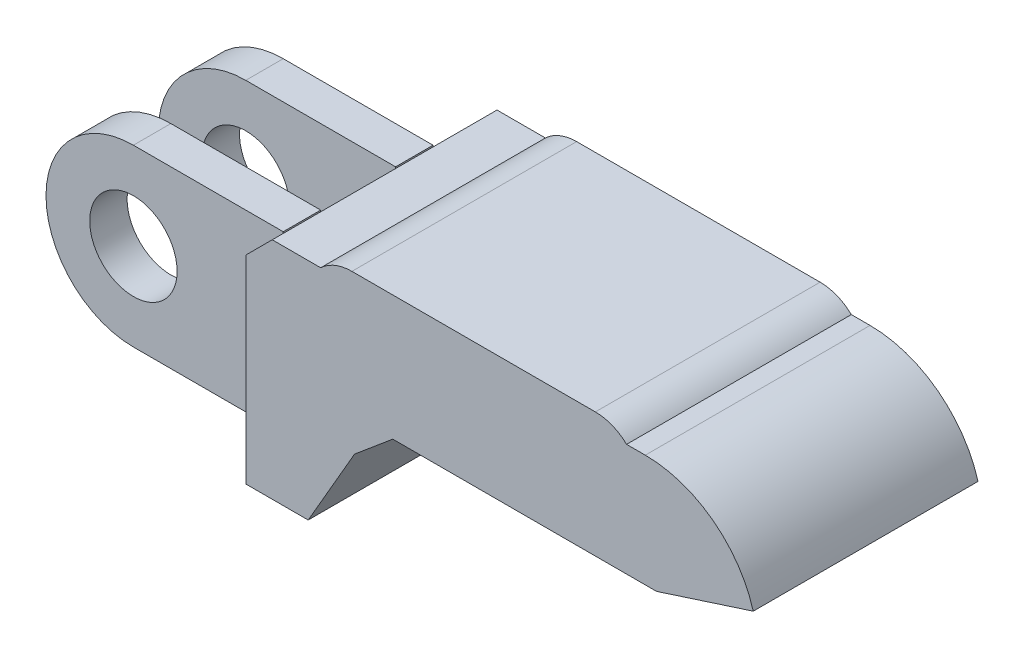
from build123d import *

# Parameters (mm, degrees)
EXTRUDE_472_DEPTH        = 9
CUT_EXTRUDE_914_DEPTH    = 46.672748987
EXTRUDE_3_DEPTH          = 18
CUT_EXTRUDE_3_DEPTH      = 46.564039844
EXTRUDE_5_DEPTH          = 9
SWEEP_START              = -4.881222858
SWEEP_1_DEPTH            = 13.189100313
SKETCH_5_R               = 3.5
EXTRUDE_2_DEPTH          = 6
SKETCH_11_W              = 23.723512942
SKETCH_11_H              = 14
CUT_EXTRUDE_4_DEPTH      = 3
SKETCH_12_W              = 6
SKETCH_12_H              = 2.5
EXTRUDE_4_DEPTH          = 10
HOLE_WIZARD_M2_5_2_D     = 2.05
HOLE_WIZARD_M2_5_2_DEPTH = 2.5
HOLE_WIZARD_M2_5_2_TIP   = 0.615882135


with BuildPart() as part:
    # 草图1 → Extrude 472 (new, symmetric)
    with BuildSketch(Plane.XY):
        with BuildLine():
            Line((0, 9), (32, 9))
            ThreePointArc((32, 9), (41, 0), (32, -9))
            Line((32, -9), (0, -9))
            Line((0, -9), (0, 9))
        make_face()
    extrude(amount=EXTRUDE_472_DEPTH, both=True)

    # 草图13 → Cut-Extrude 914 (cut, through all)
    with BuildSketch(Plane.XY.offset(9)):
        with BuildLine():
            Line((5, -9), (32, -9))
            ThreePointArc((32, -9), (39.193747285, -5.408326913), (40.645808233, 2.5))
            Line((40.645808233, 2.5), (32.896719487, 0))
            Line((32.896719487, 0), (10.196152423, 0))
            Line((10.196152423, 0), (5, -9))
        make_face()
    extrude(amount=-CUT_EXTRUDE_914_DEPTH, mode=Mode.SUBTRACT)

    # 草图6 → 凸台-拉伸3 (add)
    with BuildSketch(Plane.XY.offset(9)):
        with BuildLine():
            Line((28, 10), (8.5, 10))
            ThreePointArc((8.5, 10), (7.153708798, 9.740728004), (6, 9))
            Line((6, 9), (30.5, 9))
            ThreePointArc((30.5, 9), (29.346291202, 9.740728004), (28, 10))
        make_face()
    extrude(amount=-EXTRUDE_3_DEPTH)

    # 草图7 → 切除-拉伸3 (cut, through all)
    with BuildSketch(Plane.XY.offset(9)):
        Polygon((2.121320344, 9), (0, 9), (0, 6.878679656), align=None)
    extrude(amount=-CUT_EXTRUDE_3_DEPTH, mode=Mode.SUBTRACT)

    # 草图14 → 凸台-拉伸5 (add, symmetric)
    with BuildSketch(Plane.XY):
        Polygon((11.775875797, 0), (8.711698025, -2.571150439), (8.711698025, 0), align=None)
    extrude(amount=EXTRUDE_5_DEPTH, both=True)

    # 切除-扫描1: read off the stored shape, not the designer's step
    # 切除-扫描1 outline → 切除-扫描1 (cut)
    with BuildSketch(Plane(origin=(0, 0, 0), x_dir=(0.7087101663277271, 0.7054997520507894, 0), z_dir=(0.7054997520507895, -0.708710166327727, 0)).offset(SWEEP_START)):
        with BuildLine():
            add(Edge.make_bspline(
                [(7.598390407, 0), (7.598390407, 2.5), (5.107415447, 2.5), (5.107415447, 0), (5.107415447, -2.5), (7.598390407, -2.5), (7.598390407, 0)],
                knots=[0, 0, 0, 0, 0.5, 0.5, 0.5, 1, 1, 1, 1], degree=3, weights=[1, 0.333333333, 0.333333333, 1, 0.333333333, 0.333333333, 1]))
        make_face()
    extrude(amount=SWEEP_1_DEPTH, mode=Mode.SUBTRACT)

    # 草图5 → 凸台-拉伸2 (add, symmetric)
    with BuildSketch(Plane.XY):
        with BuildLine():
            Line((0, 7), (-12, 7))
            ThreePointArc((-12, 7), (-19, 0), (-12, -7))
            Line((-12, -7), (0, -7))
            Line((0, -7), (0, 7))
        make_face()
        with Locations((-12, 0)):
            Circle(SKETCH_5_R, mode=Mode.SUBTRACT)
    extrude(amount=EXTRUDE_2_DEPTH, both=True)

    # 草图11 → 切除-拉伸4 (cut, symmetric)
    with BuildSketch(Plane.XY):
        with Locations((-11.861756471, 0)):
            Rectangle(SKETCH_11_W, SKETCH_11_H)
    extrude(amount=CUT_EXTRUDE_4_DEPTH, both=True, mode=Mode.SUBTRACT)

    # 草图12 → 凸台-拉伸4 (add)
    with BuildSketch(Plane.ZY):
        with Locations((0, -5.75)):
            Rectangle(SKETCH_12_W, SKETCH_12_H)
    extrude(amount=EXTRUDE_4_DEPTH)

    # M2.5 螺纹孔2
    with Locations(Plane(origin=(19.775875797, 0, 0), x_dir=(0, 0, -1), z_dir=(0, -1, 0))):
        with Locations((0, 0)):
            Hole(HOLE_WIZARD_M2_5_2_D / 2, depth=HOLE_WIZARD_M2_5_2_DEPTH)
            with Locations((0, 0, -(HOLE_WIZARD_M2_5_2_DEPTH + HOLE_WIZARD_M2_5_2_TIP / 2))):  # 118° drill point
                Cone(0, HOLE_WIZARD_M2_5_2_D / 2, HOLE_WIZARD_M2_5_2_TIP, mode=Mode.SUBTRACT)


solid = part.part
